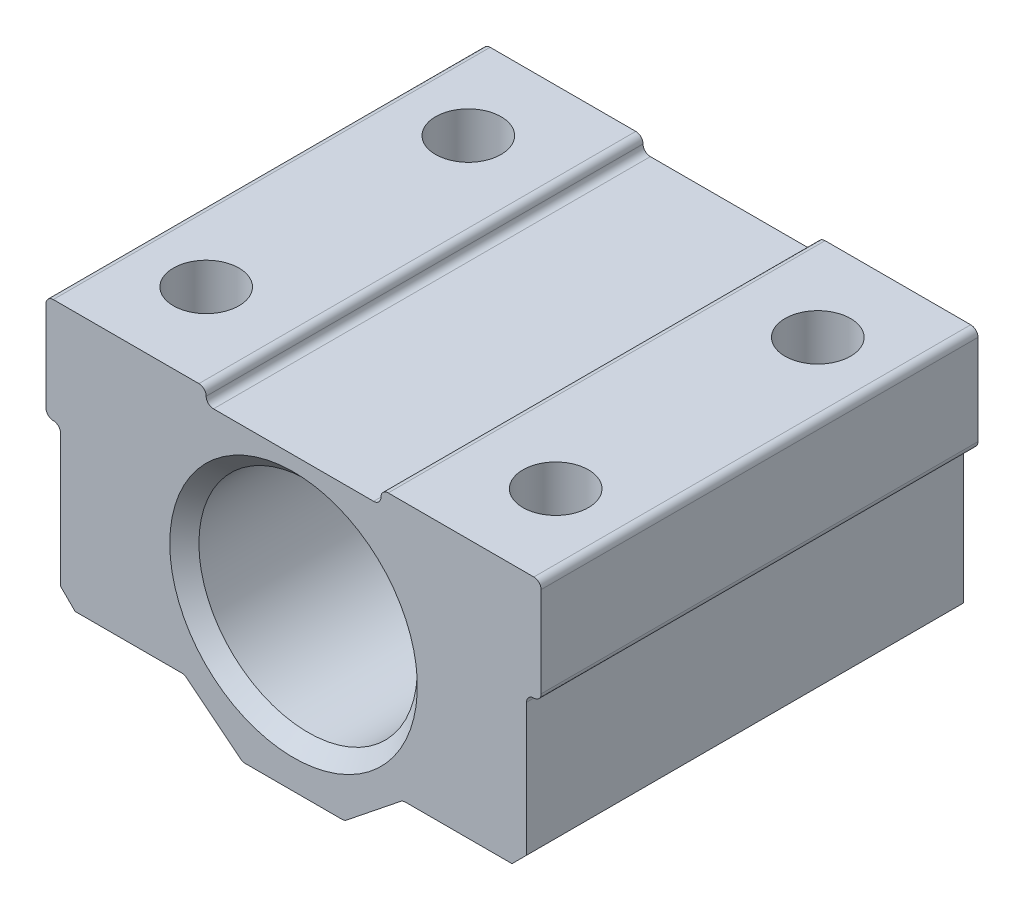
from build123d import *

# Parameters (mm, degrees)
ESTRUSIONE_ESTRUSIONE1_DEPTH = 30
SCHIZZO3_R                   = 7.5
TAGLIO_ESTRUSIONE2_DEPTH     = 50.969990995
SMUSSO1_SIZE                 = 1
RACCORDO1_R                  = 0.5
FORO_PER_VITE_M4_1_D         = 4.5


with BuildPart() as part:
    # Schizzo2 → Estrusione-Estrusione1 (new body)
    with BuildSketch(Plane.XY):
        Polygon((0, 0), (11, 0), (11, -1), (23, -1), (23, 0), (34, 0), (34, -7.2), (33, -7.2), (33, -17.8), (24.5, -17.8), (20.5, -21), (13.5, -21), (9.5, -17.8), (1, -17.8), (1, -7.2), (0, -7.2), align=None)
    extrude(amount=-ESTRUSIONE_ESTRUSIONE1_DEPTH)

    # Schizzo3 → Taglio-Estrusione2 (cut, through all)
    with BuildSketch(Plane.XY):
        with Locations((17, -10.5)):
            Circle(SCHIZZO3_R)
    extrude(amount=-TAGLIO_ESTRUSIONE2_DEPTH, mode=Mode.SUBTRACT)

    # Smusso1
    smusso1_edges = [part.edges().sort_by_distance(p)[0] for p in [
        (33, -17.8, -15),
        (1, -17.8, -15),
        (9.5, -10.5, -30),
        (9.5, -10.5, 0),
    ]]
    chamfer(smusso1_edges, length=SMUSSO1_SIZE)

    # Raccordo1
    raccordo1_edges = [part.edges().sort_by_distance(p)[0] for p in [
        (9.5, -17.8, -15),
        (24.5, -17.8, -15),
        (20.5, -21, -15),
        (13.5, -21, -15),
        (1, -7.2, -15),
        (0, -7.2, -15),
        (0, 0, -15),
        (23, -1, -15),
        (11, -1, -15),
        (11, 0, -15),
        (23, 0, -15),
        (34, 0, -15),
        (34, -7.2, -15),
        (33, -7.2, -15),
    ]]
    fillet(raccordo1_edges, radius=RACCORDO1_R - 0.0001)  # a hair under: the kernel refuses the full size

    # Foro per Vite M4-1 (through all)
    with Locations(Plane(origin=(0, 0, 0), x_dir=(1, 0, 0), z_dir=(0, 1, 0))):
        with Locations((29, 24), (29, 6), (5, 6), (5, 24)):
            Hole(FORO_PER_VITE_M4_1_D / 2)


solid = part.part
